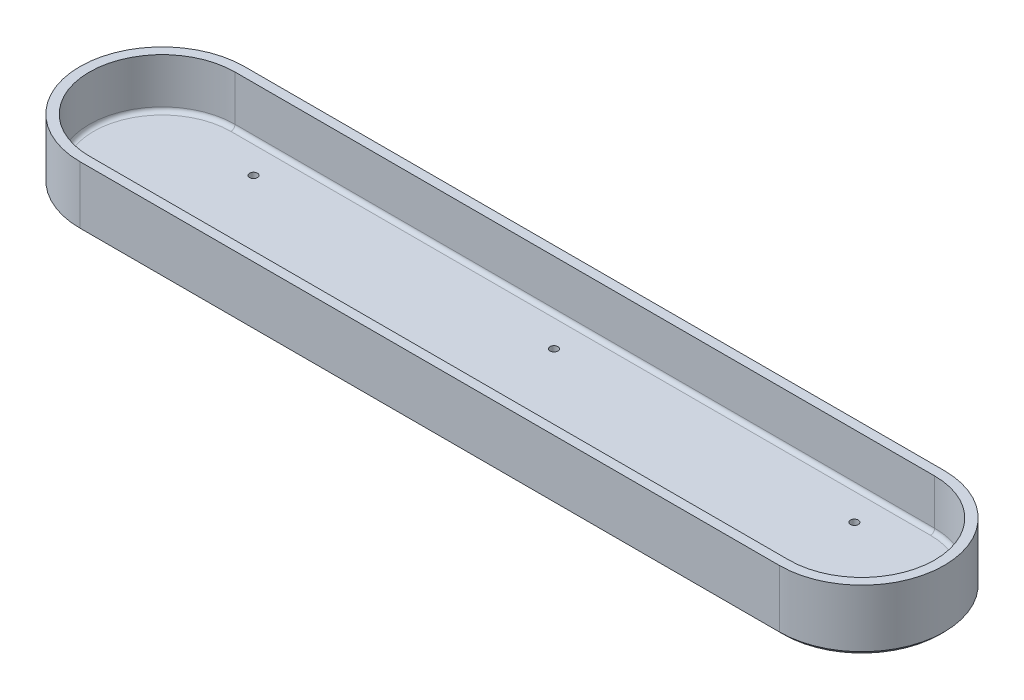
from build123d import *

# Parameters (mm, degrees)
MAINBLOCK_DEPTH     = 3.81
BOSS_EXTRUDE1_DEPTH = 19.05
SKETCH3_R           = 1.2065
CUT_EXTRUDE1_DEPTH  = 138.07766047
FILLET1_R           = 1.27
CHAMFER1_SIZE       = 1.27


with BuildPart() as part:
    # Sketch1 → MainBlock (new body)
    with BuildSketch(Plane(origin=(0, 0, 0), x_dir=(1, 0, 0), z_dir=(0, 1, 0))):
        with BuildLine():
            Line((-107.95, 22.479), (107.95, 22.479))
            ThreePointArc((107.95, 22.479), (130.429, 0), (107.95, -22.479))
            Line((107.95, -22.479), (-107.95, -22.479))
            ThreePointArc((-107.95, -22.479), (-130.429, 0), (-107.95, 22.479))
        make_face()
    extrude(amount=MAINBLOCK_DEPTH)

    # Sketch2 → Boss-Extrude1 (add)
    with BuildSketch(Plane.XZ):
        with BuildLine():
            Line((-107.95, 25.4), (107.95, 25.4))
            ThreePointArc((107.95, 25.4), (133.35, 0), (107.95, -25.4))
            Line((107.95, -25.4), (-107.95, -25.4))
            ThreePointArc((-107.95, -25.4), (-133.35, 0), (-107.95, 25.4))
        make_face()
        with BuildLine():
            Line((107.95, 22.479), (-107.95, 22.479))
            ThreePointArc((-107.95, 22.479), (-130.429, 0), (-107.95, -22.479))
            Line((-107.95, -22.479), (107.95, -22.479))
            ThreePointArc((107.95, -22.479), (130.429, 0), (107.95, 22.479))
        make_face(mode=Mode.SUBTRACT)
    extrude(amount=-BOSS_EXTRUDE1_DEPTH)

    # Sketch3 → Cut-Extrude1 (cut, through all)
    with BuildSketch(Plane.XZ):
        with Locations((0, 12.954)):
            Circle(SKETCH3_R)
        with Locations((-92.71, 12.954)):
            Circle(SKETCH3_R)
        with Locations((92.71, 12.954)):
            Circle(SKETCH3_R)
        with Locations((92.71, -12.954)):
            Circle(SKETCH3_R)
        with Locations((-92.71, -12.954)):
            Circle(SKETCH3_R)
        with Locations((0, -12.954)):
            Circle(SKETCH3_R)
    extrude(amount=-CUT_EXTRUDE1_DEPTH, mode=Mode.SUBTRACT)

    # Fillet1
    fillet1_edges = [part.edges().sort_by_distance(p)[0] for p in [
        (130.429, 3.81, 0),
        (0, 3.81, 22.479),
        (-130.429, 3.81, 0),
        (0, 3.81, -22.479),
    ]]
    fillet(fillet1_edges, radius=FILLET1_R)

    # Chamfer1
    chamfer1_edges = [part.edges().sort_by_distance(p)[0] for p in [
        (0, 0, 25.4),
        (-133.35, 0, 0),
        (133.35, 0, 0),
        (0, 0, -25.4),
    ]]
    chamfer(chamfer1_edges, length=CHAMFER1_SIZE)


solid = part.part
